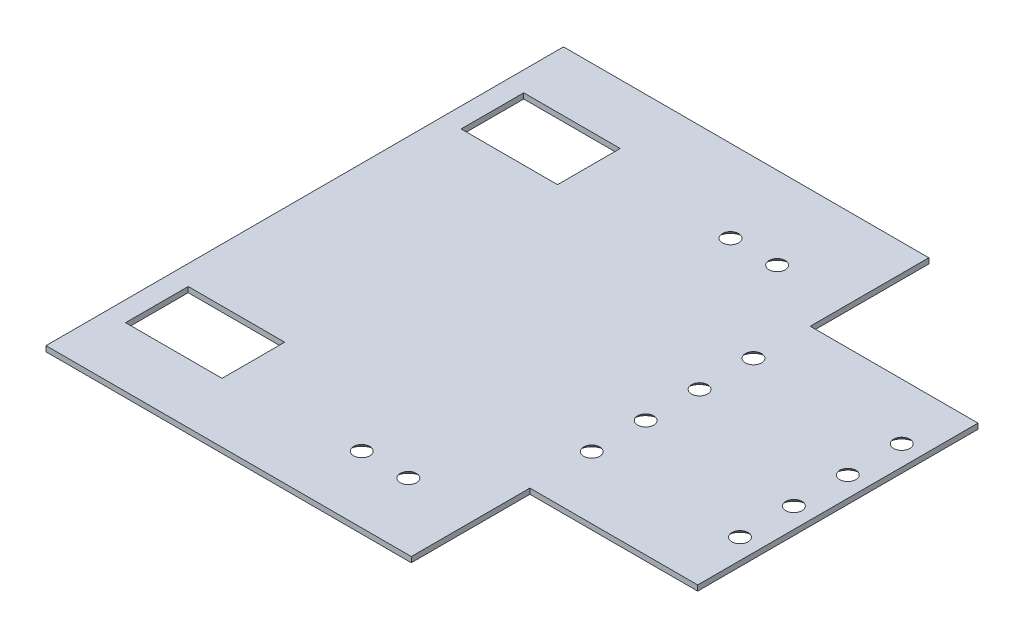
from build123d import *

# Parameters (mm, degrees)
SKETCH_1_W          = 17.893001423
SKETCH_1_H          = 11.620982588
SKETCH_1_H_2        = 11.620982589
EXTRUDE_1_DEPTH     = 1
SKETCH_2_R          = 1.5
CUT_EXTRUDE_1_DEPTH = 10
CHAMFER_1_SIZE      = 1
SKETCH_3_R          = 1.5
CUT_EXTRUDE_2_DEPTH = 10
CHAMFER_2_SIZE      = 1


with BuildPart() as part:
    # Эскиз1 → Бобышка-Вытянуть1 (new body)
    with BuildSketch(Plane(origin=(0, 0, 0), x_dir=(1, 0, 0), z_dir=(0, 1, 0))):
        Polygon((49.933797981, 26), (18.809932441, 26), (18.809932441, 48), (15, 48), (-48.959081244, 48), (-48.959081244, -48), (15, -48), (18.809932441, -48), (18.809932441, -26), (49.933797981, -26), align=None)
        with Locations((-36.319088007, -31.12001489)):
            Rectangle(SKETCH_1_W, SKETCH_1_H, mode=Mode.SUBTRACT)
        with Locations((-36.319088007, 31.12001489)):
            Rectangle(SKETCH_1_W, SKETCH_1_H_2, mode=Mode.SUBTRACT)
    extrude(amount=EXTRUDE_1_DEPTH)

    # Эскиз2 → Вырез-Вытянуть1 (cut)
    with BuildSketch(Plane(origin=(0, 1, 0), x_dir=(1, 0, 0), z_dir=(0, 1, 0))):
        with Locations(Location((46.183797981, -14.4, 0), (0, 0, 270))):
            Circle(SKETCH_2_R)
        with Locations(Location((18.683797981, -14.4, 0), (0, 0, 270))):
            Circle(SKETCH_2_R)
        with Locations(Location((18.683797981, -4.4, 0), (0, 0, 270))):
            Circle(SKETCH_2_R)
        with Locations(Location((46.183797981, -4.4, 0), (0, 0, 270))):
            Circle(SKETCH_2_R)
        with Locations(Location((18.683797981, 5.6, 0), (0, 0, 270))):
            Circle(SKETCH_2_R)
        with Locations(Location((46.183797981, 5.6, 0), (0, 0, 270))):
            Circle(SKETCH_2_R)
        with Locations(Location((18.683797981, 15.6, 0), (0, 0, 270))):
            Circle(SKETCH_2_R)
        with Locations(Location((46.183797981, 15.6, 0), (0, 0, 270))):
            Circle(SKETCH_2_R)
    extrude(amount=-CUT_EXTRUDE_1_DEPTH, mode=Mode.SUBTRACT)

    # Фаска1
    chamfer_1_edges = [part.edges().sort_by_distance(p)[0] for p in [
        (46.183797981, 0, -7.1),
        (18.683797981, 0, 2.9),
        (46.183797981, 0, 2.9),
        (18.683797981, 0, 12.9),
        (18.683797981, 0, -17.1),
        (46.183797981, 0, -17.1),
        (18.683797981, 0, -7.1),
        (46.183797981, 0, 12.9),
    ]]
    chamfer(chamfer_1_edges, length=CHAMFER_1_SIZE - 0.0001)  # a hair under: the kernel refuses the full size

    # Эскиз3 → Вырез-Вытянуть2 (cut)
    with BuildSketch(Plane(origin=(0, 1, 0), x_dir=(1, 0, 0), z_dir=(0, 1, 0))):
        with Locations(Location((5.923569009, 32.746976788, 0), (0, 0, 270))):
            Circle(SKETCH_3_R)
        with Locations(Location((-2.726430991, 32.746976788, 0), (0, 0, 270))):
            Circle(SKETCH_3_R)
        with Locations(Location((-2.726430991, -35.660220789, 0), (0, 0, 270))):
            Circle(SKETCH_3_R)
        with Locations(Location((5.923569009, -35.660220789, 0), (0, 0, 270))):
            Circle(SKETCH_3_R)
    extrude(amount=-CUT_EXTRUDE_2_DEPTH, mode=Mode.SUBTRACT)

    # Фаска2
    chamfer_2_edges = [part.edges().sort_by_distance(p)[0] for p in [
        (5.923569009, 0, 34.160220789),
        (-2.726430991, 0, 34.160220789),
        (-2.726430991, 0, -34.246976788),
        (5.923569009, 0, -34.246976788),
    ]]
    chamfer(chamfer_2_edges, length=CHAMFER_2_SIZE - 0.0001)  # a hair under: the kernel refuses the full size


solid = part.part
